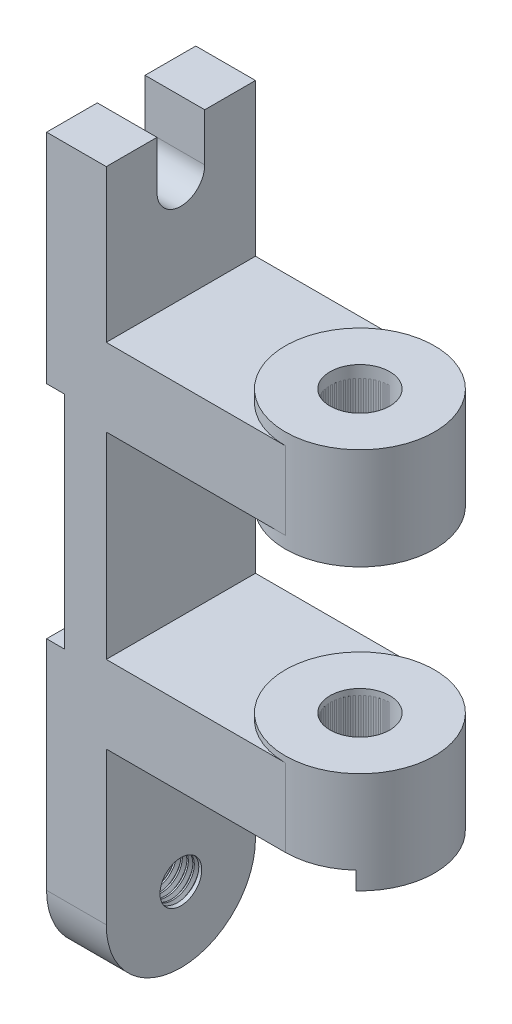
from build123d import *

# Parameters (mm, degrees)
BOSS_EXTRUDE1_DEPTH     = 25
BOSS_EXTRUDE2_START     = 29
SKETCH2_R               = 25
BOSS_EXTRUDE2_DEPTH     = 34
BOSS_EXTRUDE3_START     = -31
SKETCH2_2_R             = 25
BOSS_EXTRUDE3_DEPTH     = 34
CUT_EXTRUDE1_DEPTH      = 20
SKETCH4_R               = 25
BOSS_EXTRUDE4_DEPTH     = 20
SKETCH5_R               = 7
CUT_EXTRUDE2_DEPTH      = 20
THREAD1_PITCH           = 2
SKETCH12_R              = 10
CUT_EXTRUDE4_DEPTH      = 140
CUT_EXTRUDE5_DEPTH      = 170.266062848
CUT_EXTRUDE5_DEPTH_BACK = 170.266062848
SKETCH13_W              = 34
SKETCH13_H              = 12


with BuildPart() as part:
    # Sketch1 → Boss-Extrude1 (new, symmetric)
    with BuildSketch(Plane.XY):
        Polygon((0, -37), (0, 37), (-6, 37), (-6, 110), (14, 110), (14, 59), (74, 59), (74, 33), (14, 33), (14, -33), (74, -33), (74, -59), (14, -59), (14, -110), (-6, -110), (-6, -37), align=None)
    extrude(amount=BOSS_EXTRUDE1_DEPTH, both=True)

    # Sketch3 → Cut-Extrude1 (cut)
    with BuildSketch(Plane(origin=(14, 0, 0), x_dir=(0, 0, -1), z_dir=(1, 0, 0))):
        with BuildLine():
            Line((8, 110), (8, 94))
            ThreePointArc((8, 94), (0, 86), (-8, 94))
            Line((-8, 94), (-8, 110))
            Line((-8, 110), (8, 110))
        make_face()
    extrude(amount=-CUT_EXTRUDE1_DEPTH, mode=Mode.SUBTRACT)

    # Sketch4 → Boss-Extrude4 (add)
    with BuildSketch(Plane(origin=(14, 0, 0), x_dir=(0, 0, -1), z_dir=(1, 0, 0))):
        with Locations((0, -110)):
            Circle(SKETCH4_R)
    extrude(amount=-BOSS_EXTRUDE4_DEPTH)

    # Sketch5 → Cut-Extrude2 (cut)
    with BuildSketch(Plane(origin=(14, 0, 0), x_dir=(0, 0, -1), z_dir=(1, 0, 0))):
        with Locations(Location((0, -110, 0), (0, 0, 90))):
            Circle(SKETCH5_R)
    extrude(amount=-CUT_EXTRUDE2_DEPTH, mode=Mode.SUBTRACT)

    # Thread1: the profile of Thread Profile1 profile screwed along a right-hand helix of 11 turns, 10 arcs to a turn; built about Z, then put on its axis
    thread1_z = Axis((0, 0, 0), (0, 0, 1))
    thread1_corners = [(6.9997, 0, -0.000173205), (8.08253175, 0, 0.624999997), (8.08253175, 0, 0.874999997), (6.9997, 0, 1.5001732)]
    with BuildLine(mode=Mode.PRIVATE) as thread1_profile:
        Line(thread1_corners[0], thread1_corners[1])
        Line(thread1_corners[1], thread1_corners[2])
        Line(thread1_corners[2], thread1_corners[3])
        Line(thread1_corners[3], thread1_corners[0])
    thread1_cap = Face(thread1_profile.wire())
    thread1_turn_angles = [0, 18, 36, 54, 72, 90, 108, 126, 144, 162, 180, 198, 216, 234, 252, 270, 288, 306, 324, 342, 360]
    thread1_turn_weights = [1, 0.9510565162951535, 1, 0.9510565162951535, 1, 0.9510565162951535, 1, 0.9510565162951535, 1, 0.9510565162951535, 1, 0.9510565162951535, 1, 0.9510565162951535, 1, 0.9510565162951535, 1, 0.9510565162951535, 1, 0.9510565162951535, 1]
    thread1_turn_rails = [Edge.make_bspline([Vector(p[0], p[1], 0).rotate(thread1_z, thread1_turn_angles[k]) / thread1_turn_weights[k] + Vector(0, 0, p[2] + THREAD1_PITCH * thread1_turn_angles[k] / 360) for k in range(21)], [0, 0, 0, 1, 1, 2, 2, 3, 3, 4, 4, 5, 5, 6, 6, 7, 7, 8, 8, 9, 9, 10, 10, 10], 2, thread1_turn_weights) for p in thread1_corners]
    thread1_turn_sides = [Face.make_surface_from_curves(thread1_turn_rails[p[0]], thread1_turn_rails[p[1]]) for p in [(0, 1), (1, 2), (2, 3), (3, 0)]]
    thread1 = Plane(origin=(14, -110, 0), x_dir=(0, 0, 1), z_dir=(-1, 0, 0)) * Solid(Shell([*[p.moved(Location((0, 0, THREAD1_PITCH * i))) for i in range(11) for p in thread1_turn_sides], thread1_cap, thread1_cap.rotate(thread1_z, 3960).moved(Location((0, 0, THREAD1_PITCH * 3960 / 360)))]))
    add(thread1, mode=Mode.SUBTRACT)


with BuildPart() as body_2:
    # Sketch2 → Boss-Extrude2 (new body)
    with BuildSketch(Plane(origin=(0, 0, 0), x_dir=(1, 0, 0), z_dir=(0, 1, 0)).offset(BOSS_EXTRUDE2_START)):
        with Locations(Location((74, 0, 0), (0, 0, 270))):
            Circle(SKETCH2_R)
    extrude(amount=BOSS_EXTRUDE2_DEPTH)


with BuildPart() as body_3:
    # Sketch2<2> → Boss-Extrude3 (new body)
    with BuildSketch(Plane(origin=(0, 0, 0), x_dir=(1, 0, 0), z_dir=(0, 1, 0)).offset(BOSS_EXTRUDE3_START)):
        with Locations(Location((74, 0, 0), (0, 0, 270))):
            Circle(SKETCH2_2_R)
    extrude(amount=-BOSS_EXTRUDE3_DEPTH)


with BuildPart() as cut_extrude4_tool:
    # Sketch12 → Cut-Extrude4 (new body)
    with BuildSketch(Plane.XZ.offset(65)):
        with Locations(Location((74, 0, 0), (0, 0, 270))):
            Circle(SKETCH12_R)
    extrude(amount=-CUT_EXTRUDE4_DEPTH)


with BuildPart() as part_1:
    add(part.part)

    # Cut-Extrude4: cut by cut_extrude4_tool
    add(cut_extrude4_tool.part, mode=Mode.SUBTRACT)


with BuildPart() as body_2_1:
    add(body_2.part)

    # Cut-Extrude4: cut by cut_extrude4_tool
    add(cut_extrude4_tool.part, mode=Mode.SUBTRACT)


with BuildPart() as body_3_1:
    add(body_3.part)

    # Cut-Extrude4: cut by cut_extrude4_tool
    add(cut_extrude4_tool.part, mode=Mode.SUBTRACT)

    # Sketch13 → Cut-Extrude5 (cut, two sides: drawn at the far end of the back side and taken through both)
    with BuildSketch(Plane.XY.offset(-CUT_EXTRUDE5_DEPTH_BACK)):
        with Locations((74, -65)):
            Rectangle(SKETCH13_W, SKETCH13_H)
    extrude(amount=CUT_EXTRUDE5_DEPTH + CUT_EXTRUDE5_DEPTH_BACK, mode=Mode.SUBTRACT)


solid = Compound([part_1.part, body_2_1.part, body_3_1.part])
